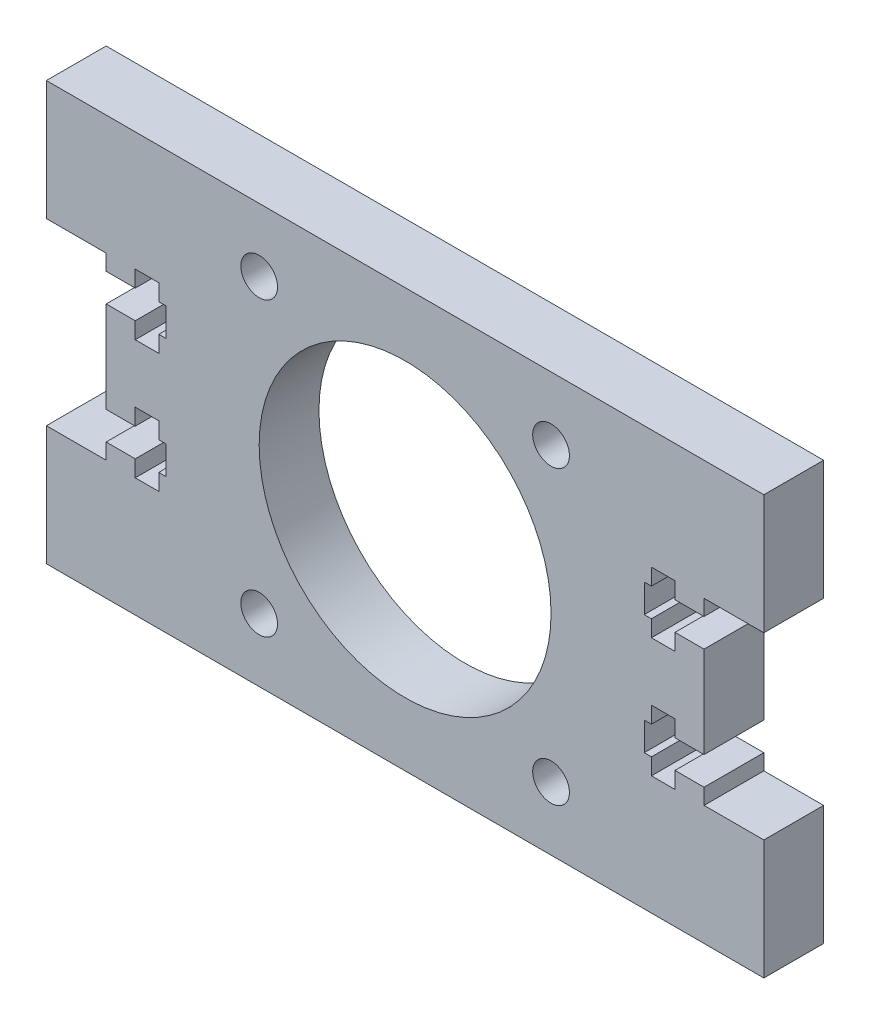
from build123d import *

# Parameters (mm, degrees)
SKETCH2_R           = 1.95
SKETCH2_R_2         = 15.5
BOSS_EXTRUDE1_DEPTH = 6.35
SKETCH3_W           = 3.175
SKETCH3_H           = 12.7
BOSS_EXTRUDE2_DEPTH = 6.35


with BuildPart() as part:
    # Sketch2 → Boss-Extrude1 (new body)
    with BuildSketch(Plane.XY):
        Polygon((-3.175, 0), (66.675, 0), (66.675, 12.7), (63.5, 12.7), (63.5, 14.375), (60.412, 14.375), (60.412, 12.625), (57.912, 12.625), (57.912, 14.375), (57.15, 14.375), (57.15, 17.375), (57.912, 17.375), (57.912, 19.125), (60.412, 19.125), (60.412, 17.375), (63.5, 17.375), (63.5, 27.075), (60.412, 27.075), (60.412, 25.325), (57.912, 25.325), (57.912, 27.075), (57.15, 27.075), (57.15, 30.075), (57.912, 30.075), (57.912, 31.825), (60.412, 31.825), (60.412, 30.075), (63.5, 30.075), (63.5, 31.75), (66.675, 31.75), (66.675, 44.45), (-3.175, 44.45), (-3.175, 31.75), (0, 31.75), (0, 30.075), (3.088, 30.075), (3.088, 31.825), (5.588, 31.825), (5.588, 30.075), (6.35, 30.075), (6.35, 27.075), (5.588, 27.075), (5.588, 25.325), (3.088, 25.325), (3.088, 27.075), (0, 27.075), (0, 17.375), (3.088, 17.375), (3.088, 19.125), (5.588, 19.125), (5.588, 17.375), (6.35, 17.375), (6.35, 14.375), (5.588, 14.375), (5.588, 12.625), (3.088, 12.625), (3.088, 14.375), (0, 14.375), (0, 12.7), (-3.175, 12.7), align=None)
        with Locations((16.25, 6.725)):
            Circle(SKETCH2_R, mode=Mode.SUBTRACT)
        with Locations((47.25, 6.725)):
            Circle(SKETCH2_R, mode=Mode.SUBTRACT)
        with Locations((16.25, 37.725)):
            Circle(SKETCH2_R, mode=Mode.SUBTRACT)
        with Locations((31.75, 22.225)):
            Circle(SKETCH2_R_2, mode=Mode.SUBTRACT)
        with Locations((47.25, 37.725)):
            Circle(SKETCH2_R, mode=Mode.SUBTRACT)
    extrude(amount=BOSS_EXTRUDE1_DEPTH)

    # Sketch3 → Boss-Extrude2 (add)
    with BuildSketch(Plane(origin=(0, 0, 0), x_dir=(-1, 0, 0), z_dir=(0, 0, -1))):
        with Locations((4.7625, 6.35)):
            Rectangle(SKETCH3_W, SKETCH3_H)
        with Locations((4.7625, 38.1)):
            Rectangle(SKETCH3_W, SKETCH3_H)
        with Locations((-68.2625, 38.1)):
            Rectangle(SKETCH3_W, SKETCH3_H)
        with Locations((-68.2625, 6.35)):
            Rectangle(SKETCH3_W, SKETCH3_H)
    extrude(amount=-BOSS_EXTRUDE2_DEPTH)


solid = part.part
